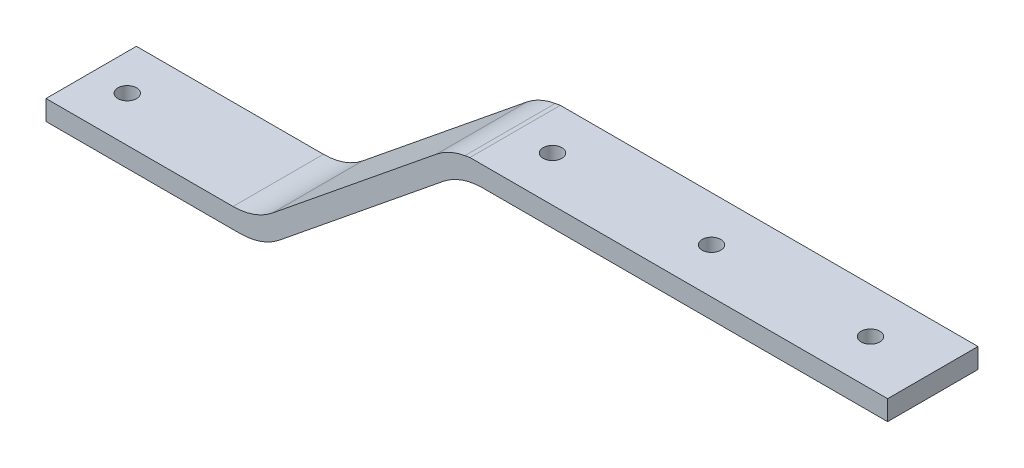
from build123d import *

# Parameters (mm, degrees)
BOSS_EXTRUDE1_DEPTH = 14.5
SKETCH3_R           = 1.5
CUT_EXTRUDE1_DEPTH  = 76.334255157


with BuildPart() as part:
    # Sketch2 → Boss-Extrude1 (new body)
    with BuildSketch(Plane.XY):
        with BuildLine():
            Line((0, 41.360359775), (67, 41.360359775))
            Line((67, 41.360359775), (67, 38.160359775))
            Line((67, 38.160359775), (2.044161335, 38.160359775))
            ThreePointArc((2.044161335, 38.160359775), (-1.29678146, 37.585756385), (-4.253780843, 35.927980024))
            Line((-4.253780843, 35.927980024), (-30.567780148, 14.592739527))
            ThreePointArc((-30.567780148, 14.592739527), (-33.524779531, 12.934963166), (-36.865722326, 12.360359775))
            Line((-36.865722326, 12.360359775), (-68, 12.360359775))
            Line((-68, 12.360359775), (-68, 15.560359775))
            Line((-68, 15.560359775), (-38, 15.560359775))
            ThreePointArc((-38, 15.560359775), (-34.659057205, 16.134963166), (-31.702057822, 17.792739527))
            Line((-31.702057822, 17.792739527), (-5.377247568, 39.13674548))
            ThreePointArc((-5.377247568, 39.13674548), (-3.225270493, 40.469178713), (-0.807686987, 41.218627608))
            Line((-0.807686987, 41.218627608), (0, 41.360359775))
        make_face()
    extrude(amount=BOSS_EXTRUDE1_DEPTH)

    # Sketch3 → Cut-Extrude1 (cut, through all)
    with BuildSketch(Plane(origin=(0, 41.360359775, 0), x_dir=(1, 0, 0), z_dir=(0, 1, 0))):
        with Locations((6, -7.25)):
            Circle(SKETCH3_R)
        with Locations((31.5, -7.25)):
            Circle(SKETCH3_R)
        with Locations((57, -7.25)):
            Circle(SKETCH3_R)
        with Locations((-62.214915759, -7.25)):
            Circle(SKETCH3_R)
    extrude(amount=-CUT_EXTRUDE1_DEPTH, mode=Mode.SUBTRACT)


solid = part.part
